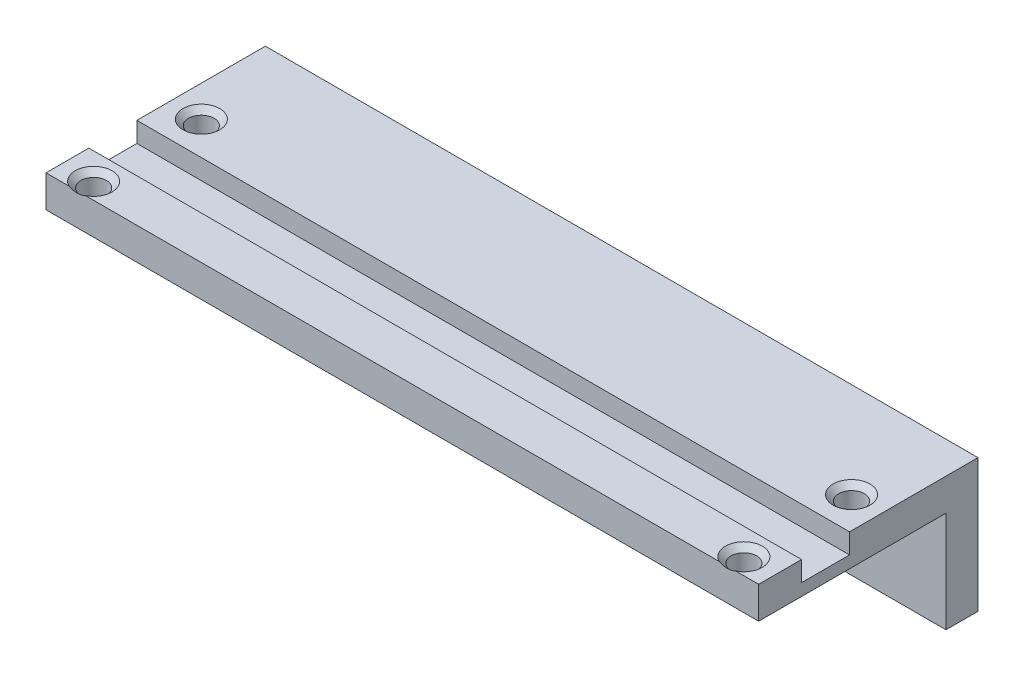
from build123d import *

# Parameters (mm, degrees)
SKETCH1_W           = 89
SKETCH1_H           = 24
BOSS_EXTRUDE1_DEPTH = 4
SKETCH2_R           = 1.6
CUT_EXTRUDE1_DEPTH  = 47.262836057
CHAMFER1_SIZE       = 0.7
SKETCH3_W           = 89
SKETCH3_H           = 6
CUT_EXTRUDE2_DEPTH  = 2.5
SKETCH4_W           = 89
SKETCH4_H           = 4
BOSS_EXTRUDE2_DEPTH = 3.39
SKETCH5_W           = 89
SKETCH5_H           = 4
BOSS_EXTRUDE3_DEPTH = 12.62


with BuildPart() as part:
    # Sketch1 → Boss-Extrude1 (new body)
    with BuildSketch(Plane(origin=(0, 0, 0), x_dir=(1, 0, 0), z_dir=(0, 1, 0))):
        Rectangle(SKETCH1_W, SKETCH1_H)
    extrude(amount=BOSS_EXTRUDE1_DEPTH)

    # Sketch2 → Cut-Extrude1 (cut, through all)
    with BuildSketch(Plane(origin=(0, 4, 0), x_dir=(1, 0, 0), z_dir=(0, 1, 0))):
        with Locations(Location((-40.6, 3.5, 0), (0, 0, 270))):
            Circle(SKETCH2_R)
        with Locations(Location((-40.6, -9.95, 0), (0, 0, 270))):
            Circle(SKETCH2_R)
        with Locations(Location((40.6, 3.5, 0), (0, 0, 270))):
            Circle(SKETCH2_R)
        with Locations(Location((40.6, -9.95, 0), (0, 0, 270))):
            Circle(SKETCH2_R)
    extrude(amount=-CUT_EXTRUDE1_DEPTH, mode=Mode.SUBTRACT)

    # Chamfer1
    # the kernel refuses this chamfer: 0.7 mm, written as the material it takes off along each edge
    with BuildSketch(Plane(origin=(40.6, 4, 9.95), x_dir=(0, 0, 1), z_dir=(-1, 0, 0))) as chamfer1_piece_1:
        Polygon((1.6 + CHAMFER1_SIZE, 0), (1.6, -CHAMFER1_SIZE), (1.6, 0), align=None)
    revolve(axis=Axis((40.6, 4, 9.95), (0, 1, 0)), mode=Mode.SUBTRACT)
    with BuildSketch(Plane(origin=(-40.6, 4, -3.5), x_dir=(0, 0, 1), z_dir=(-1, 0, 0))) as chamfer1_piece_2:
        Polygon((1.6 + CHAMFER1_SIZE, 0), (1.6, -CHAMFER1_SIZE), (1.6, 0), align=None)
    revolve(axis=Axis((-40.6, 4, -3.5), (0, 1, 0)), mode=Mode.SUBTRACT)
    with BuildSketch(Plane(origin=(40.6, 4, -3.5), x_dir=(0, 0, 1), z_dir=(-1, 0, 0))) as chamfer1_piece_3:
        Polygon((1.6 + CHAMFER1_SIZE, 0), (1.6, -CHAMFER1_SIZE), (1.6, 0), align=None)
    revolve(axis=Axis((40.6, 4, -3.5), (0, 1, 0)), mode=Mode.SUBTRACT)
    with BuildSketch(Plane(origin=(-40.6, 4, 9.95), x_dir=(0, 0, 1), z_dir=(-1, 0, 0))) as chamfer1_piece_4:
        Polygon((1.6 + CHAMFER1_SIZE, 0), (1.6, -CHAMFER1_SIZE), (1.6, 0), align=None)
    revolve(axis=Axis((-40.6, 4, 9.95), (0, 1, 0)), mode=Mode.SUBTRACT)

    # Sketch3 → Cut-Extrude2 (cut)
    with BuildSketch(Plane(origin=(0, 4, 0), x_dir=(1, 0, 0), z_dir=(0, 1, 0))):
        with Locations((0, -3.65)):
            Rectangle(SKETCH3_W, SKETCH3_H)
    extrude(amount=-CUT_EXTRUDE2_DEPTH, mode=Mode.SUBTRACT)

    # Sketch4 → Boss-Extrude2 (add)
    with BuildSketch(Plane(origin=(0, 0, -12), x_dir=(-1, 0, 0), z_dir=(0, 0, -1))):
        with Locations((0, 2)):
            Rectangle(SKETCH4_W, SKETCH4_H)
    extrude(amount=BOSS_EXTRUDE2_DEPTH)

    # Sketch5 → Boss-Extrude3 (add)
    with BuildSketch(Plane.XZ):
        with Locations((0, -13.39)):
            Rectangle(SKETCH5_W, SKETCH5_H)
    extrude(amount=BOSS_EXTRUDE3_DEPTH)


solid = part.part
